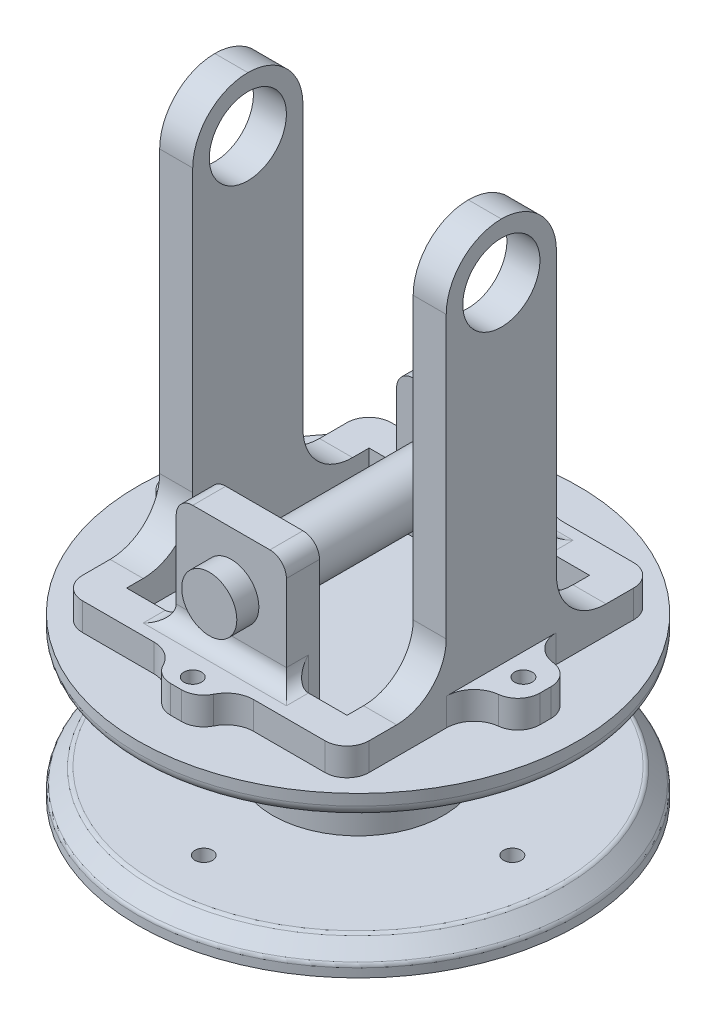
from build123d import *

# Parameters (mm, degrees)
CROQUIS1_R               = 40
CROQUIS1_R_2             = 1.6
SALIENTE_EXTRUIR1_DEPTH  = 5
CHAFL_N1_SIZE            = 3
REDONDEO1_R              = 1
CORTAR_EXTRUIR1_DEPTH    = 5
SALIENTE_EXTRUIR3_DEPTH  = 8
CROQUIS6_R               = 4.1
SALIENTE_EXTRUIR4_DEPTH  = 5
CROQUIS7_R               = 12.5
SALIENTE_EXTRUIR5_DEPTH  = 8
CROQUIS9_R               = 15.5
CROQUIS9_R_2             = 12.5
SALIENTE_EXTRUIR7_DEPTH  = 20
SALIENTE_EXTRUIR8_START  = -12
CROQUIS10_R              = 12.5
CROQUIS10_R_2            = 8.1
SALIENTE_EXTRUIR8_DEPTH  = 12
CROQUIS11_R              = 40
SALIENTE_EXTRUIR9_DEPTH  = 4
REDONDEO2_R              = 10
CORTAR_EXTRUIR2_DEPTH    = 10
SALIENTE_EXTRUIR10_DEPTH = 2
REDONDEO3_R              = 2
CROQUIS14_R              = 1.6
CORTAR_EXTRUIR3_DEPTH    = 4
CROQUIS15_R              = 1.6
CROQUIS15_W              = 40
CROQUIS15_H              = 44
SALIENTE_EXTRUIR11_DEPTH = 5
REDONDEO4_R              = 4
CROQUIS16_W              = 6
CROQUIS16_H              = 20
SALIENTE_EXTRUIR12_DEPTH = 70
REDONDEO5_R              = 10
CORTAR_EXTRUIR4_REACH    = 131.507
CROQUIS18_R              = 7
REDONDEO6_R              = 9
REDONDEO7_R              = 5
CROQUIS19_W              = 20
CROQUIS19_H              = 5
SALIENTE_EXTRUIR13_DEPTH = 5
CROQUIS20_W              = 20
CROQUIS20_H              = 6
SALIENTE_EXTRUIR14_DEPTH = 20
CORTAR_EXTRUIR5_REACH    = 130.004
CROQUIS21_R              = 5
REDONDEO9_R              = 3
REDONDEO10_R             = 3
CROQUIS22_R              = 5
SALIENTE_EXTRUIR15_DEPTH = 50
CROQUIS23_R              = 5
SALIENTE_EXTRUIR16_DEPTH = 4


# Some blends are built 0.0001 mm under size
with BuildPart() as part:
    # Croquis1 → Saliente-Extruir1 (new body)
    with BuildSketch(Plane(origin=(0, 0, 0), x_dir=(1, 0, 0), z_dir=(0, 1, 0))):
        with Locations(Location((0, 0, 0), (0, 0, 270))):
            Circle(CROQUIS1_R)
        with Locations(Location((0, 28, 0), (0, 0, 270))):
            Circle(CROQUIS1_R_2, mode=Mode.SUBTRACT)
        with Locations(Location((28, 0, 0), (0, 0, 270))):
            Circle(CROQUIS1_R_2, mode=Mode.SUBTRACT)
        with Locations(Location((0, -28, 0), (0, 0, 270))):
            Circle(CROQUIS1_R_2, mode=Mode.SUBTRACT)
        with Locations(Location((-28, 0, 0), (0, 0, 270))):
            Circle(CROQUIS1_R_2, mode=Mode.SUBTRACT)
    extrude(amount=SALIENTE_EXTRUIR1_DEPTH)

    # Chaflán1
    chafl_n1_edges = [part.edges().sort_by_distance(p)[0] for p in [
        (0, 5, -40),
    ]]
    chamfer(chafl_n1_edges, length=CHAFL_N1_SIZE)

    # Redondeo1
    redondeo1_edges = [part.edges().sort_by_distance(p)[0] for p in [
        (0, 5, -37),
        (0, 2, -40),
    ]]
    fillet(redondeo1_edges, radius=REDONDEO1_R)

    # Croquis4 → Cortar-Extruir1 (cut)
    with BuildSketch(Plane(origin=(0, 5, 0), x_dir=(1, 0, 0), z_dir=(0, 1, 0))):
        Polygon((0, 7.505553499), (-6.5, 3.75277675), (-6.5, -3.75277675), (0, -7.505553499), (6.5, -3.75277675), (6.5, 3.75277675), align=None)
    extrude(amount=-CORTAR_EXTRUIR1_DEPTH, mode=Mode.SUBTRACT)

    # Croquis5 → Saliente-Extruir3 (add)
    with BuildSketch(Plane(origin=(0, 5, 0), x_dir=(1, 0, 0), z_dir=(0, 1, 0))):
        Polygon((0, 10.969655115), (-9.5, 5.484827557), (-9.5, -5.484827557), (0, -10.969655115), (9.5, -5.484827557), (9.5, 5.484827557), align=None)
        Polygon((0, 7.505553499), (-6.5, 3.75277675), (-6.5, -3.75277675), (0, -7.505553499), (6.5, -3.75277675), (6.5, 3.75277675), align=None, mode=Mode.SUBTRACT)
    extrude(amount=SALIENTE_EXTRUIR3_DEPTH)

    # Croquis6 → Saliente-Extruir4 (add)
    with BuildSketch(Plane(origin=(0, 13, 0), x_dir=(1, 0, 0), z_dir=(0, 1, 0))):
        Polygon((0, 7.505553499), (-6.5, 3.75277675), (-6.5, -3.75277675), (0, -7.505553499), (6.5, -3.75277675), (6.5, 3.75277675), align=None)
        with Locations(Location((0, 0, 0), (0, 0, 270))):
            Circle(CROQUIS6_R, mode=Mode.SUBTRACT)
    extrude(amount=-SALIENTE_EXTRUIR4_DEPTH)

    # Croquis7 → Saliente-Extruir5 (add)
    with BuildSketch(Plane(origin=(0, 5, 0), x_dir=(1, 0, 0), z_dir=(0, 1, 0))):
        with Locations(Location((0, 0, 0), (0, 0, 270))):
            Circle(CROQUIS7_R)
        Polygon((9.5, 5.484827557), (0, 10.969655115), (-9.5, 5.484827557), (-9.5, -5.484827557), (0, -10.969655115), (9.5, -5.484827557), align=None, mode=Mode.SUBTRACT)
    extrude(amount=SALIENTE_EXTRUIR5_DEPTH)


with BuildPart() as body_2:
    # Croquis9 → Saliente-Extruir7 (new body)
    with BuildSketch(Plane(origin=(0, 5, 0), x_dir=(1, 0, 0), z_dir=(0, 1, 0))):
        with Locations(Location((0, 0, 0), (0, 0, 270))):
            Circle(CROQUIS9_R)
        with Locations(Location((0, 0, 0), (0, 0, 270))):
            Circle(CROQUIS9_R_2, mode=Mode.SUBTRACT)
    extrude(amount=SALIENTE_EXTRUIR7_DEPTH)

    # Croquis10 → Saliente-Extruir8 (add)
    with BuildSketch(Plane(origin=(0, 25, 0), x_dir=(1, 0, 0), z_dir=(0, 1, 0)).offset(SALIENTE_EXTRUIR8_START)):
        with Locations(Location((0, 0, 0), (0, 0, 270))):
            Circle(CROQUIS10_R)
        with Locations(Location((0, 0, 0), (0, 0, 270))):
            Circle(CROQUIS10_R_2, mode=Mode.SUBTRACT)
    extrude(amount=SALIENTE_EXTRUIR8_DEPTH)

    # Croquis11 → Saliente-Extruir9 (add)
    with BuildSketch(Plane(origin=(0, 25, 0), x_dir=(1, 0, 0), z_dir=(0, 1, 0))):
        with Locations(Location((0, 0, 0), (0, 0, 270))):
            Circle(CROQUIS11_R)
    extrude(amount=SALIENTE_EXTRUIR9_DEPTH)

    # Redondeo2
    redondeo2_edges = [body_2.edges().sort_by_distance(p)[0] for p in [
        (0, 25, -15.5),
    ]]
    fillet(redondeo2_edges, radius=REDONDEO2_R)

    # Croquis12 → Cortar-Extruir2 (cut)
    with BuildSketch(Plane(origin=(0, 29, 0), x_dir=(1, 0, 0), z_dir=(0, 1, 0))):
        Polygon((0, 7.505553499), (-6.5, 3.75277675), (-6.5, -3.75277675), (0, -7.505553499), (6.5, -3.75277675), (6.5, 3.75277675), align=None)
    extrude(amount=-CORTAR_EXTRUIR2_DEPTH, mode=Mode.SUBTRACT)

    # Croquis13 → Saliente-Extruir10 (add)
    with BuildSketch(Plane(origin=(0, 29, 0), x_dir=(1, 0, 0), z_dir=(0, 1, 0))):
        Polygon((-6.5, 3.75277675), (-6.5, -3.75277675), (0, -7.505553499), (6.5, -3.75277675), (6.5, 3.75277675), (0, 7.505553499), align=None)
    extrude(amount=-SALIENTE_EXTRUIR10_DEPTH)

    # Redondeo3
    redondeo3_edges = [body_2.edges().sort_by_distance(p)[0] for p in [
        (0, 25, -40),
    ]]
    fillet(redondeo3_edges, radius=REDONDEO3_R)

    # Croquis14 → Cortar-Extruir3 (cut)
    with BuildSketch(Plane(origin=(0, 29, 0), x_dir=(1, 0, 0), z_dir=(0, 1, 0))):
        with Locations(Location((0, 30, 0), (0, 0, 270))):
            Circle(CROQUIS14_R)
        with Locations(Location((30, 0, 0), (0, 0, 270))):
            Circle(CROQUIS14_R)
        with Locations(Location((0, -30, 0), (0, 0, 270))):
            Circle(CROQUIS14_R)
        with Locations(Location((-30, 0, 0), (0, 0, 270))):
            Circle(CROQUIS14_R)
    extrude(amount=-CORTAR_EXTRUIR3_DEPTH, mode=Mode.SUBTRACT)


with BuildPart() as body_3:
    # Croquis15 → Saliente-Extruir11 (new body)
    with BuildSketch(Plane(origin=(0, 29, 0), x_dir=(1, 0, 0), z_dir=(0, 1, 0))):
        Polygon((26, -28), (5, -28), (5, -33), (-5, -33), (-5, -28), (-26, -28), (-26, -5), (-34, -5), (-34, 5), (-26, 5), (-26, 28), (-5, 28), (-5, 33), (5, 33), (5, 28), (26, 28), (26, 5), (34, 5), (34, -5), (26, -5), align=None)
        with Locations(Location((0, -30, 0), (0, 0, 270))):
            Circle(CROQUIS15_R, mode=Mode.SUBTRACT)
        with Locations(Location((30, 0, 0), (0, 0, 270))):
            Circle(CROQUIS15_R, mode=Mode.SUBTRACT)
        with Locations(Location((0, 30, 0), (0, 0, 270))):
            Circle(CROQUIS15_R, mode=Mode.SUBTRACT)
        with Locations(Location((-30, 0, 0), (0, 0, 270))):
            Circle(CROQUIS15_R, mode=Mode.SUBTRACT)
        Rectangle(CROQUIS15_W, CROQUIS15_H, mode=Mode.SUBTRACT)
    extrude(amount=SALIENTE_EXTRUIR11_DEPTH)

    # Redondeo4
    redondeo4_edges = [body_3.edges().sort_by_distance(p)[0] for p in [
        (-5, 31.5, -33),
        (5, 31.5, -33),
        (26, 31.5, -28),
        (34, 31.5, -5),
        (34, 31.5, 5),
        (26, 31.5, 28),
        (5, 31.5, 33),
        (-5, 31.5, 33),
        (-26, 31.5, 28),
        (-34, 31.5, 5),
        (-34, 31.5, -5),
        (-26, 31.5, -28),
    ]]
    fillet(redondeo4_edges, radius=REDONDEO4_R)

    # Croquis16 → Saliente-Extruir12 (add)
    with BuildSketch(Plane(origin=(0, 34, 0), x_dir=(1, 0, 0), z_dir=(0, 1, 0))):
        with Locations((-23, 0)):
            Rectangle(CROQUIS16_W, CROQUIS16_H)
        with Locations((23, 0)):
            Rectangle(CROQUIS16_W, CROQUIS16_H)
    extrude(amount=SALIENTE_EXTRUIR12_DEPTH)

    # Redondeo5
    redondeo5_edges = [body_3.edges().sort_by_distance(p)[0] for p in [
        (23, 104, -10),
        (23, 104, 10),
        (-23, 104, -10),
        (-23, 104, 10),
    ]]
    fillet(redondeo5_edges, radius=REDONDEO5_R - 0.0001)  # a hair under: the kernel refuses the full size

    # Cortar-Extruir4: up to this face of the body (flat: up to its plane)
    cortar_extruir4_end = Plane(body_3.part.faces().sort_by_distance((26, 63.485538795, 0))[0])
    # Croquis18 → Cortar-Extruir4 (cut, up to the picked face)
    with BuildSketch(Plane.ZY.offset(26), mode=Mode.PRIVATE) as cortar_extruir4_sk1:
        with Locations((0, 94)):
            Circle(CROQUIS18_R)
    cortar_extruir4_tool1 = split(extrude(cortar_extruir4_sk1.sketch, amount=-CORTAR_EXTRUIR4_REACH, mode=Mode.PRIVATE), bisect_by=cortar_extruir4_end, keep=Keep.BOTH, mode=Mode.PRIVATE)
    add(cortar_extruir4_tool1.solids().sort_by(Axis((-26, 94, 0), (1, 0, 0)))[0], mode=Mode.SUBTRACT)

    # Redondeo6
    redondeo6_edges = [body_3.edges().sort_by_distance(p)[0] for p in [
        (-23, 34, -10),
        (-23, 34, 10),
        (23, 34, 10),
        (23, 34, -10),
    ]]
    fillet(redondeo6_edges, radius=REDONDEO6_R)

    # Redondeo7
    # the kernel refuses this fillet: 5 mm, written as the material it adds along each edge
    with BuildSketch(Plane(origin=(5, 29, -28), x_dir=(1, 0, 0), z_dir=(0, 1, 0))) as redondeo7_piece_1:
        with BuildLine():
            CenterArc((4.062257748, 5), REDONDEO7_R, 206.387799961, 63.612200039)
            Line((-0.416774334, 2.777777778), (-0.864677542, 2.555555556))
            ThreePointArc((-0.864677542, 2.555555556), (-0.5, 1), (-0.5, 0))
            Line((-0.5, 0), (0, -0.5))
            Line((0, -0.5), (4.062257748, -0.5))
            Line((4.062257748, -0.5), (4.062257748, 0))
        make_face()
    extrude(amount=5)
    with BuildSketch(Plane(origin=(-5, 29, -28), x_dir=(0.14837794057356674, 0, -0.9889307289952856), z_dir=(0, 1, 0))) as redondeo7_piece_2:
        with BuildLine():
            CenterArc((4.341904206, 4.759181219), REDONDEO7_R, 188.532937529, 63.612200039)
            Line((-0.602749439, 4.017291516), (-1.097214803, 3.943102546))
            Line((-1.097214803, 3.943102546), (-0.494465364, -0.07418897))
            Line((-0.494465364, -0.07418897), (0.07418897, -0.494465364))
            ThreePointArc((0.07418897, -0.494465364), (1.063119699, -0.346087424), (2.655566492, -0.475918122))
            Line((2.655566492, -0.475918122), (2.80886992, 0))
        make_face()
    extrude(amount=5)
    with BuildSketch(Plane(origin=(-26, 29, -5), x_dir=(0, 0, -1), z_dir=(0, 1, 0)), Plane(origin=(26, 29, 5), x_dir=(0, 0, 1), z_dir=(0, 1, 0))) as redondeo7_piece_3:
        with BuildLine():
            CenterArc((4.94427191, 5), REDONDEO7_R, 186.379370208, 83.620629792)
            Line((-0.02476804, 4.444444444), (-0.521672035, 4.388888889))
            ThreePointArc((-0.521672035, 4.388888889), (-0.5, 4), (-0.5, 0))
            Line((-0.5, 0), (0, -0.5))
            Line((0, -0.5), (4.94427191, -0.5))
            Line((4.94427191, -0.5), (4.94427191, 0))
        make_face()
    extrude(amount=5)
    with BuildSketch(Plane(origin=(-26, 29, 5), x_dir=(0, 0, 1), z_dir=(0, 1, 0)), Plane(origin=(26, 29, -5), x_dir=(0, 0, -1), z_dir=(0, 1, 0))) as redondeo7_piece_4:
        with BuildLine():
            CenterArc((4.94427191, -5), REDONDEO7_R, 90, 83.620629792)
            Line((-0.02476804, -4.444444444), (-0.521672035, -4.388888889))
            ThreePointArc((-0.521672035, -4.388888889), (-0.5, -4), (-0.5, 0))
            Line((-0.5, 0), (0, 0.5))
            Line((0, 0.5), (4.94427191, 0.5))
            Line((4.94427191, 0.5), (4.94427191, 0))
        make_face()
    extrude(amount=5)
    with BuildSketch(Plane(origin=(-5, 29, 28), x_dir=(0.14837794057356815, 0, 0.9889307289952854), z_dir=(0, 1, 0))) as redondeo7_piece_5:
        with BuildLine():
            CenterArc((4.341904206, -4.759181219), REDONDEO7_R, 107.854862432, 63.612200039)
            Line((-0.602749439, -4.017291516), (-1.097214803, -3.943102546))
            Line((-1.097214803, -3.943102546), (-0.494465364, 0.07418897))
            Line((-0.494465364, 0.07418897), (0.07418897, 0.494465364))
            ThreePointArc((0.07418897, 0.494465364), (1.063119699, 0.346087424), (2.655566492, 0.475918122))
            Line((2.655566492, 0.475918122), (2.80886992, 0))
        make_face()
    extrude(amount=5)
    with BuildSketch(Plane(origin=(5, 29, 28), x_dir=(1, 0, 0), z_dir=(0, 1, 0))) as redondeo7_piece_6:
        with BuildLine():
            CenterArc((4.062257748, -5), REDONDEO7_R, 90, 63.612200039)
            Line((-0.416774334, -2.777777778), (-0.864677542, -2.555555556))
            ThreePointArc((-0.864677542, -2.555555556), (-0.5, -1), (-0.5, 0))
            Line((-0.5, 0), (0, 0.5))
            Line((0, 0.5), (4.062257748, 0.5))
            Line((4.062257748, 0.5), (4.062257748, 0))
        make_face()
    extrude(amount=5)

    # Croquis19 → Saliente-Extruir13 (add)
    with BuildSketch(Plane(origin=(0, 34, 0), x_dir=(1, 0, 0), z_dir=(0, 1, 0))):
        with Locations((0, -19.5)):
            Rectangle(CROQUIS19_W, CROQUIS19_H)
        with Locations((0, 19.5)):
            Rectangle(CROQUIS19_W, CROQUIS19_H)
    extrude(amount=-SALIENTE_EXTRUIR13_DEPTH)

    # Croquis20 → Saliente-Extruir14 (add)
    with BuildSketch(Plane(origin=(0, 34, 0), x_dir=(1, 0, 0), z_dir=(0, 1, 0))):
        with Locations((0, 20)):
            Rectangle(CROQUIS20_W, CROQUIS20_H)
        with Locations((0, -20)):
            Rectangle(CROQUIS20_W, CROQUIS20_H)
    extrude(amount=SALIENTE_EXTRUIR14_DEPTH)

    # Cortar-Extruir5: up to this face of the body (flat: up to its plane)
    cortar_extruir5_end = Plane(body_3.part.faces().sort_by_distance((0, 44, -23))[0])
    # Croquis21 → Cortar-Extruir5 (cut, up to the picked face)
    with BuildSketch(Plane.XY.offset(23), mode=Mode.PRIVATE) as cortar_extruir5_sk1:
        with Locations((0, 44)):
            Circle(CROQUIS21_R)
    cortar_extruir5_tool1 = split(extrude(cortar_extruir5_sk1.sketch, amount=-CORTAR_EXTRUIR5_REACH, mode=Mode.PRIVATE), bisect_by=cortar_extruir5_end, keep=Keep.BOTH, mode=Mode.PRIVATE)
    add(cortar_extruir5_tool1.solids().sort_by(Axis((0, 44, 23), (0, 0, -1)))[0], mode=Mode.SUBTRACT)

    # Redondeo9
    redondeo9_edges = [body_3.edges().sort_by_distance(p)[0] for p in [
        (-10, 31.5, 22),
        (10, 31.5, 22),
        (-10, 31.5, -22),
        (10, 31.5, -22),
        (0, 34, -23),
        (-10, 54, -20),
        (10, 54, -20),
        (0, 34, 23),
        (-10, 54, 20),
        (10, 54, 20),
    ]]
    fillet(redondeo9_edges, radius=REDONDEO9_R)

    # Redondeo10
    redondeo10_edges = [body_3.edges().sort_by_distance(p)[0] for p in [
        (-10, 34, 22.5),
        (10, 34, 22.5),
        (-10, 34, -22.5),
        (10, 34, -22.5),
    ]]
    fillet(redondeo10_edges, radius=REDONDEO10_R)


with BuildPart() as body_4:
    # Croquis22 → Saliente-Extruir15 (new body)
    with BuildSketch(Plane.XY.offset(23)):
        with Locations((0, 44)):
            Circle(CROQUIS22_R)
    extrude(amount=-SALIENTE_EXTRUIR15_DEPTH)

    # Croquis23 → Saliente-Extruir16 (add)
    with BuildSketch(Plane.XY.offset(23)):
        with Locations((0, 44)):
            Circle(CROQUIS23_R)
    extrude(amount=SALIENTE_EXTRUIR16_DEPTH)


solid = Compound([part.part, body_2.part, body_3.part, body_4.part])
